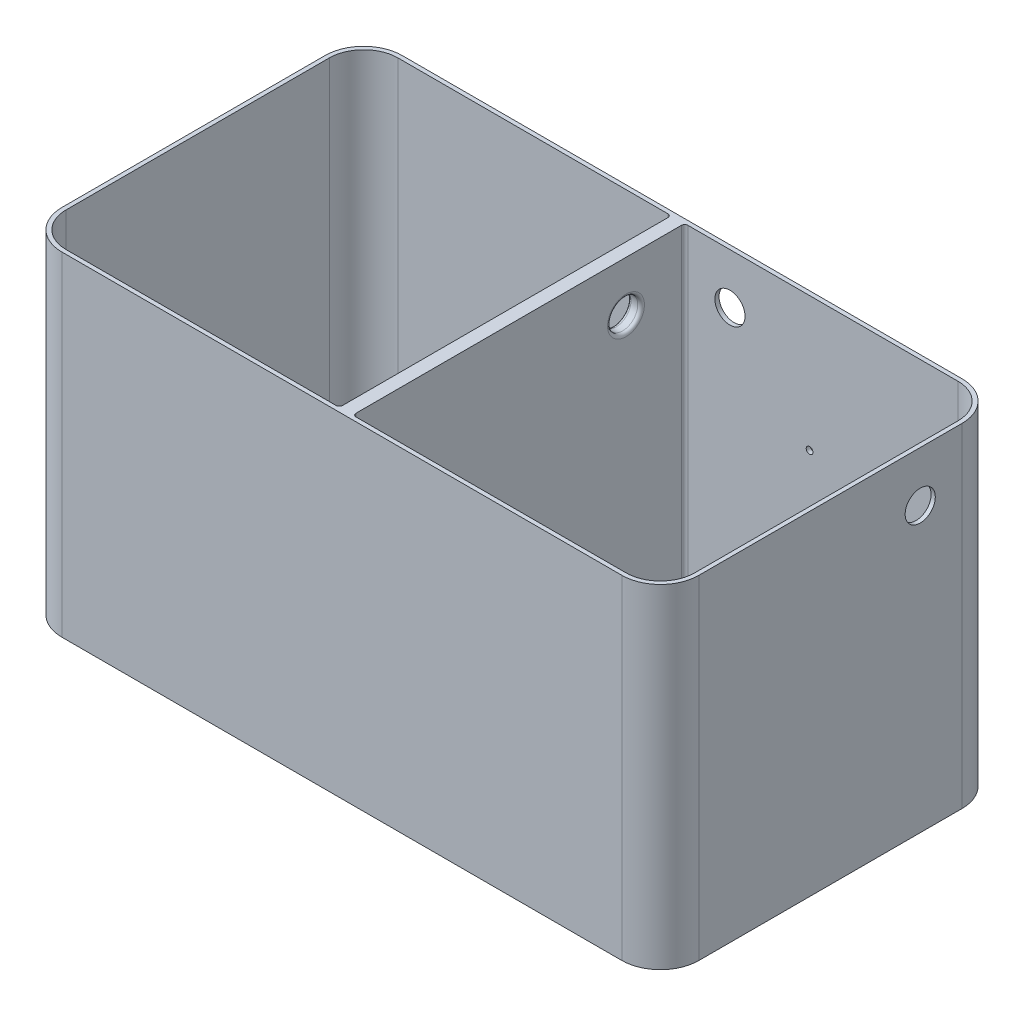
from build123d import *

# Parameters (mm, degrees)
EXTRUDE_1_DEPTH     = 199
CUT_EXTRUDE_1_DEPTH = 195
SKETCH_4_W          = 8
SKETCH_4_H          = 198
EXTRUDE_2_DEPTH     = 195
FILLET_1_R          = 2
CUT_EXTRUDE_2_REACH = 343.921
SKETCH_6_R          = 2
SKETCH_6_R_2        = 9
CUT_EXTRUDE_3_REACH = 297.87
SKETCH_7_R          = 9
FILLET_2_R          = 2
CUT_EXTRUDE_4_REACH = 442.798
SKETCH_9_R          = 9


with BuildPart() as part:
    # 草图1 → 凸台-拉伸1 (new body)
    with BuildSketch(Plane(origin=(0, 0, 0), x_dir=(1, 0, 0), z_dir=(0, 1, 0))):
        with BuildLine():
            Line((-167, 101.5), (167, 101.5))
            ThreePointArc((167, 101.5), (183.263455967, 94.763455967), (190, 78.5))
            Line((190, 78.5), (190, -78.5))
            ThreePointArc((190, -78.5), (183.263455967, -94.763455967), (167, -101.5))
            Line((167, -101.5), (-167, -101.5))
            ThreePointArc((-167, -101.5), (-183.263455967, -94.763455967), (-190, -78.5))
            Line((-190, -78.5), (-190, 78.5))
            ThreePointArc((-190, 78.5), (-183.263455967, 94.763455967), (-167, 101.5))
        make_face()
    extrude(amount=EXTRUDE_1_DEPTH)

    # 草图3 → 切除-拉伸1 (cut)
    with BuildSketch(Plane(origin=(0, 199, 0), x_dir=(1, 0, 0), z_dir=(0, 1, 0))):
        with BuildLine():
            Line((-167, 99), (167, 99))
            ThreePointArc((167, 99), (181.495689014, 92.995689014), (187.5, 78.5))
            Line((187.5, 78.5), (187.5, -78.5))
            ThreePointArc((187.5, -78.5), (181.495689014, -92.995689014), (167, -99))
            Line((167, -99), (-167, -99))
            ThreePointArc((-167, -99), (-181.495689014, -92.995689014), (-187.5, -78.5))
            Line((-187.5, -78.5), (-187.5, 78.5))
            ThreePointArc((-187.5, 78.5), (-181.495689014, 92.995689014), (-167, 99))
        make_face()
    extrude(amount=-CUT_EXTRUDE_1_DEPTH, mode=Mode.SUBTRACT)

    # 草图4 → 凸台-拉伸2 (add)
    with BuildSketch(Plane(origin=(0, 4, 0), x_dir=(1, 0, 0), z_dir=(0, 1, 0))):
        Rectangle(SKETCH_4_W, SKETCH_4_H)
    extrude(amount=EXTRUDE_2_DEPTH)

    # 圆角1
    fillet_1_edges = [part.edges().sort_by_distance(p)[0] for p in [
        (85.5, 4, 99),
        (181.495689014, 4, 92.995689014),
        (187.5, 4, 0),
        (181.495689014, 4, -92.995689014),
        (-85.5, 4, 99),
        (-181.495689014, 4, 92.995689014),
        (-187.5, 4, 0),
        (-181.495689014, 4, -92.995689014),
        (-4, 101.5, -99),
        (-4, 4, 0),
        (-4, 101.5, 99),
        (4, 101.5, 99),
        (4, 101.5, -99),
        (4, 4, 0),
        (85.5, 4, -99),
        (-85.5, 4, -99),
    ]]
    fillet(fillet_1_edges, radius=FILLET_1_R)

    # 草图6 → 切除-拉伸2 (cut, up to next)
    with BuildSketch(Plane(origin=(0, 0, -101.5), x_dir=(-1, 0, 0), z_dir=(0, 0, -1)), mode=Mode.PRIVATE) as cut_extrude_2_sk1:
        with Locations((-155, 119)):
            Circle(SKETCH_6_R)
    cut_extrude_2_tool1 = extrude(cut_extrude_2_sk1.sketch, amount=-CUT_EXTRUDE_2_REACH, mode=Mode.PRIVATE) & part.part
    # 草图6 → 切除-拉伸2 (cut, up to next)
    with BuildSketch(Plane(origin=(0, 0, -101.5), x_dir=(-1, 0, 0), z_dir=(0, 0, -1)), mode=Mode.PRIVATE) as cut_extrude_2_sk2:
        with Locations((-155, 64)):
            Circle(SKETCH_6_R)
    cut_extrude_2_tool2 = extrude(cut_extrude_2_sk2.sketch, amount=-CUT_EXTRUDE_2_REACH, mode=Mode.PRIVATE) & part.part
    # 草图6 → 切除-拉伸2 (cut, up to next)
    with BuildSketch(Plane(origin=(0, 0, -101.5), x_dir=(-1, 0, 0), z_dir=(0, 0, -1)), mode=Mode.PRIVATE) as cut_extrude_2_sk3:
        with Locations((-78.5, 64)):
            Circle(SKETCH_6_R)
    cut_extrude_2_tool3 = extrude(cut_extrude_2_sk3.sketch, amount=-CUT_EXTRUDE_2_REACH, mode=Mode.PRIVATE) & part.part
    # 草图6 → 切除-拉伸2 (cut, up to next)
    with BuildSketch(Plane(origin=(0, 0, -101.5), x_dir=(-1, 0, 0), z_dir=(0, 0, -1)), mode=Mode.PRIVATE) as cut_extrude_2_sk4:
        with Locations((-78.5, 119)):
            Circle(SKETCH_6_R)
    cut_extrude_2_tool4 = extrude(cut_extrude_2_sk4.sketch, amount=-CUT_EXTRUDE_2_REACH, mode=Mode.PRIVATE) & part.part
    # 草图6 → 切除-拉伸2 (cut, up to next)
    with BuildSketch(Plane(origin=(0, 0, -101.5), x_dir=(-1, 0, 0), z_dir=(0, 0, -1)), mode=Mode.PRIVATE) as cut_extrude_2_sk5:
        with Locations((-31, 169)):
            Circle(SKETCH_6_R_2)
    cut_extrude_2_tool5 = extrude(cut_extrude_2_sk5.sketch, amount=-CUT_EXTRUDE_2_REACH, mode=Mode.PRIVATE) & part.part
    add(cut_extrude_2_tool1.solids().sort_by_distance((155, 119, -101.5))[0], mode=Mode.SUBTRACT)
    add(cut_extrude_2_tool2.solids().sort_by_distance((155, 64, -101.5))[0], mode=Mode.SUBTRACT)
    add(cut_extrude_2_tool3.solids().sort_by_distance((78.5, 64, -101.5))[0], mode=Mode.SUBTRACT)
    add(cut_extrude_2_tool4.solids().sort_by_distance((78.5, 119, -101.5))[0], mode=Mode.SUBTRACT)
    add(cut_extrude_2_tool5.solids().sort_by_distance((31, 169, -101.5))[0], mode=Mode.SUBTRACT)

    # 草图7 → 切除-拉伸3 (cut, up to next)
    with BuildSketch(Plane(origin=(4, 0, 0), x_dir=(0, 0, -1), z_dir=(1, 0, 0)), mode=Mode.PRIVATE) as cut_extrude_3_sk1:
        with Locations((64, 169)):
            Circle(SKETCH_7_R)
    cut_extrude_3_tool1 = extrude(cut_extrude_3_sk1.sketch, amount=-CUT_EXTRUDE_3_REACH, mode=Mode.PRIVATE) & part.part
    add(cut_extrude_3_tool1.solids().sort_by_distance((4, 169, -64))[0], mode=Mode.SUBTRACT)

    # 圆角2
    fillet_2_edges = [part.edges().sort_by_distance(p)[0] for p in [
        (-4, 169, -55),
        (4, 169, -55),
    ]]
    fillet(fillet_2_edges, radius=FILLET_2_R)

    # 草图9 → 切除-拉伸4 (cut, up to next)
    with BuildSketch(Plane(origin=(190, 0, 0), x_dir=(0, 0, -1), z_dir=(1, 0, 0)), mode=Mode.PRIVATE) as cut_extrude_4_sk1:
        with Locations((53.5, 169)):
            Circle(SKETCH_9_R)
    cut_extrude_4_tool1 = extrude(cut_extrude_4_sk1.sketch, amount=-CUT_EXTRUDE_4_REACH, mode=Mode.PRIVATE) & part.part
    add(cut_extrude_4_tool1.solids().sort_by_distance((190, 169, -53.5))[0], mode=Mode.SUBTRACT)


solid = part.part
